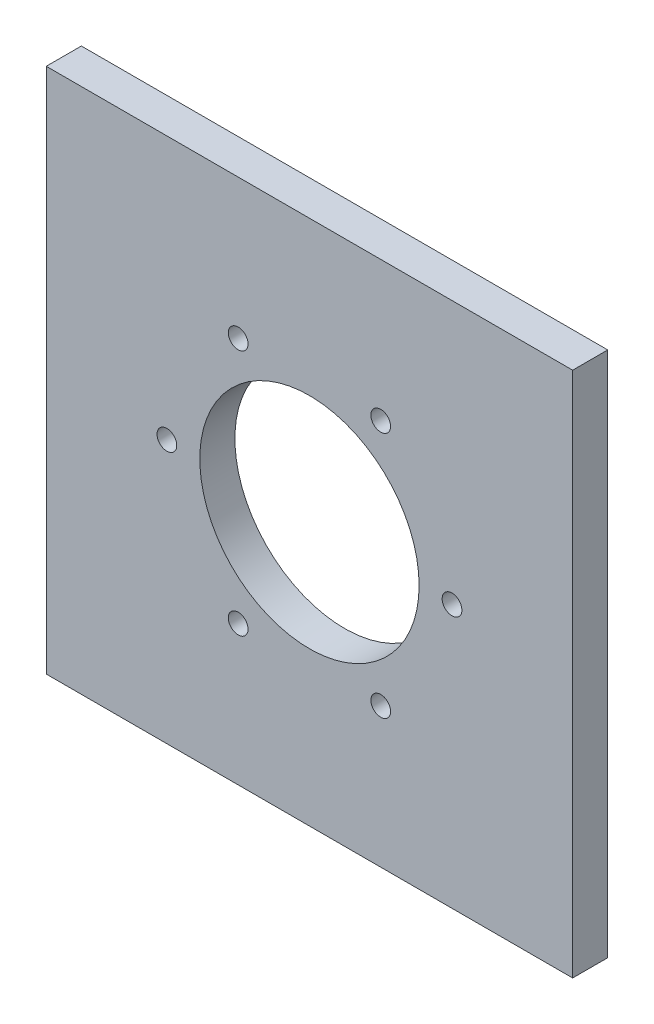
from build123d import *

# Parameters (mm, degrees)
SKETCH1_W           = 120
SKETCH1_H           = 120
SKETCH1_R           = 25
BOSS_EXTRUDE1_DEPTH = 8
SKETCH2_R           = 2.25
CUT_EXTRUDE2_DEPTH  = 86.229103011
CIRPATTERN1_COUNT   = 6


with BuildPart() as part:
    # Sketch1 → Boss-Extrude1 (new body)
    with BuildSketch(Plane.XY):
        Rectangle(SKETCH1_W, SKETCH1_H)
        Circle(SKETCH1_R, mode=Mode.SUBTRACT)
    extrude(amount=BOSS_EXTRUDE1_DEPTH)

    # Sketch2 → Cut-Extrude2 (cut, through all)
    with BuildSketch(Plane.XY):
        with Locations((-16.25, 28.145825623)):
            Circle(SKETCH2_R)
    cut_extrude2 = extrude(amount=CUT_EXTRUDE2_DEPTH, mode=Mode.SUBTRACT)

    # CirPattern1: Cut-Extrude2 ×6 about axis
    cirpattern1_axis = Axis((0, 0, 8), (0, 0, 1))
    for i in range(1, CIRPATTERN1_COUNT):
        add(cut_extrude2.rotate(cirpattern1_axis, i * 360 / CIRPATTERN1_COUNT), mode=Mode.SUBTRACT)


solid = part.part
